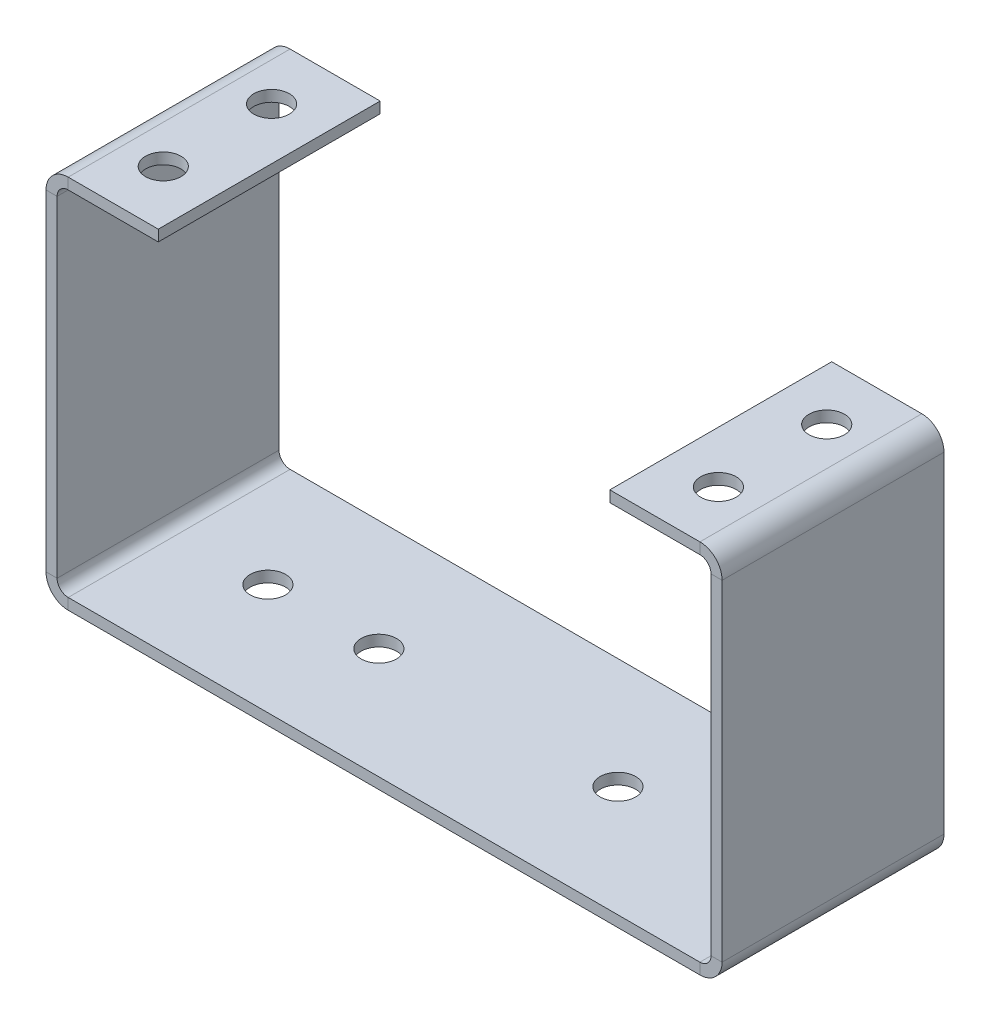
from build123d import *

# Parameters (mm, degrees)
SKETCH_2_W                  = 60.94
SKETCH_2_H                  = 20
EXTRUDE_1_DEPTH             = 1
SKETCH_3_W                  = 1
SKETCH_3_H                  = 20
EXTRUDE_2_DEPTH             = 32.81
SKETCH_4_W                  = 1
SKETCH_4_H                  = 20
EXTRUDE_3_DEPTH             = 32.81
SKETCH_9_W                  = 20
SKETCH_9_H                  = 1
EXTRUDE_8_DEPTH             = 9.12
SKETCH_10_W                 = 20
SKETCH_10_H                 = 1
EXTRUDE_9_DEPTH             = 9.12
SKETCH_13_R                 = 1.6
CUT_EXTRUDE_2_DEPTH         = 1
SKETCH_14_R                 = 1.6
CUT_EXTRUDE_3_DEPTH         = 1
SKETCH_15_R                 = 1.6
CUT_EXTRUDE_4_DEPTH         = 1
SKETCH_16_R                 = 1.6
CUT_EXTRUDE_5_DEPTH         = 1
SKETCH_17_R                 = 1.6
CUT_EXTRUDE_6_DEPTH         = 1
SKETCH_18_R                 = 1.6
CUT_EXTRUDE_7_DEPTH         = 1
SKETCH_19_R                 = 1.6
CUT_EXTRUDE_8_DEPTH         = 1
SHEET_START                 = 1
SHEET_METAL_1_OUTLINE_W     = 10.12
SHEET_METAL_1_OUTLINE_H     = 20
SHEET_METAL_1_OUTLINE_R     = 1.6
SHEET_METAL_1_DEPTH         = 32.81
SHEET_METAL_1_2_OUTLINE_W   = 40.64238898
SHEET_METAL_1_2_OUTLINE_H   = 20
SHEET_METAL_1_2_OUTLINE_R   = 1.6
SHEET_METAL_1_2_DEPTH       = 1
SHEET_START_2               = -20
SHEET_METAL_1_3_DEPTH       = 20
SHEET_START_3               = -13.2799999
SHEET_METAL_1_3_2_DEPTH     = 6.5599998
SHEET_METAL_1_3_3_DEPTH     = 3.5199999
SHEET_START_4               = -3.5199999
SHEET_METAL_1_3_4_DEPTH     = 3.5199999
SHEET_START_5               = -16.4800001
SHEET_METAL_1_3_5_DEPTH     = 12.9600002
SHEET_START_6               = 32.81
SHEET_METAL_1_3_6_OUTLINE_R = 1.6
SHEET_METAL_1_3_6_DEPTH     = 1


with BuildPart() as part:
    # Sketch 2 → ﾎﾞｽ - 押し出し1 (new body)
    with BuildSketch(Plane(origin=(0, 0, 0), x_dir=(1, 0, 0), z_dir=(0, 1, 0))):
        with Locations((30.47, 10)):
            Rectangle(SKETCH_2_W, SKETCH_2_H)
    extrude(amount=EXTRUDE_1_DEPTH)

    # ｽｹｯﾁ3 → ﾎﾞｽ - 押し出し2 (add)
    with BuildSketch(Plane(origin=(0, 1, 0), x_dir=(1, 0, 0), z_dir=(0, 1, 0))):
        with Locations((60.44, 10)):
            Rectangle(SKETCH_3_W, SKETCH_3_H)
    extrude(amount=EXTRUDE_2_DEPTH)

    # ｽｹｯﾁ4 → ﾎﾞｽ - 押し出し3 (add)
    with BuildSketch(Plane(origin=(0, 1, 0), x_dir=(1, 0, 0), z_dir=(0, 1, 0))):
        with Locations((0.5, 10)):
            Rectangle(SKETCH_4_W, SKETCH_4_H)
    extrude(amount=EXTRUDE_3_DEPTH)

    # ｽｹｯﾁ9 → ﾎﾞｽ - 押し出し8 (add)
    with BuildSketch(Plane.ZY.offset(-59.94)):
        with Locations((-10, 33.31)):
            Rectangle(SKETCH_9_W, SKETCH_9_H)
    extrude(amount=EXTRUDE_8_DEPTH)

    # ｽｹｯﾁ10 → ﾎﾞｽ - 押し出し9 (add)
    with BuildSketch(Plane(origin=(1, 0, 0), x_dir=(0, 0, -1), z_dir=(1, 0, 0))):
        with Locations((10, 33.31)):
            Rectangle(SKETCH_10_W, SKETCH_10_H)
    extrude(amount=EXTRUDE_9_DEPTH)

    # ｽｹｯﾁ13 → ｶｯﾄ - 押し出し2 (cut)
    with BuildSketch(Plane(origin=(0, 33.81, 0), x_dir=(1, 0, 0), z_dir=(0, 1, 0))):
        with Locations(Location((55.49, 5.12, 0), (0, 0, 270))):
            Circle(SKETCH_13_R)
    extrude(amount=-CUT_EXTRUDE_2_DEPTH, mode=Mode.SUBTRACT)

    # ｽｹｯﾁ14 → ｶｯﾄ - 押し出し3 (cut)
    with BuildSketch(Plane(origin=(0, 33.81, 0), x_dir=(1, 0, 0), z_dir=(0, 1, 0))):
        with Locations(Location((55.49, 14.88, 0), (0, 0, 270))):
            Circle(SKETCH_14_R)
    extrude(amount=-CUT_EXTRUDE_3_DEPTH, mode=Mode.SUBTRACT)

    # ｽｹｯﾁ15 → ｶｯﾄ - 押し出し4 (cut)
    with BuildSketch(Plane(origin=(0, 33.81, 0), x_dir=(1, 0, 0), z_dir=(0, 1, 0))):
        with Locations(Location((5.45, 5.12, 0), (0, 0, 270))):
            Circle(SKETCH_15_R)
    extrude(amount=-CUT_EXTRUDE_4_DEPTH, mode=Mode.SUBTRACT)

    # ｽｹｯﾁ16 → ｶｯﾄ - 押し出し5 (cut)
    with BuildSketch(Plane(origin=(0, 33.81, 0), x_dir=(1, 0, 0), z_dir=(0, 1, 0))):
        with Locations(Location((5.45, 14.88, 0), (0, 0, 270))):
            Circle(SKETCH_16_R)
    extrude(amount=-CUT_EXTRUDE_5_DEPTH, mode=Mode.SUBTRACT)

    # ｽｹｯﾁ17 → ｶｯﾄ - 押し出し6 (cut)
    with BuildSketch(Plane(origin=(0, 0, 0), x_dir=(-1, 0, 0), z_dir=(0, -1, 0))):
        with Locations(Location((-41.55, 10, 0), (0, 0, 90))):
            Circle(SKETCH_17_R)
    extrude(amount=-CUT_EXTRUDE_6_DEPTH, mode=Mode.SUBTRACT)

    # ｽｹｯﾁ18 → ｶｯﾄ - 押し出し7 (cut)
    with BuildSketch(Plane(origin=(0, 0, 0), x_dir=(-1, 0, 0), z_dir=(0, -1, 0))):
        with Locations(Location((-10, 10, 0), (0, 0, 90))):
            Circle(SKETCH_18_R)
    extrude(amount=-CUT_EXTRUDE_7_DEPTH, mode=Mode.SUBTRACT)

    # ｽｹｯﾁ19 → ｶｯﾄ - 押し出し8 (cut)
    with BuildSketch(Plane(origin=(0, 0, 0), x_dir=(-1, 0, 0), z_dir=(0, -1, 0))):
        with Locations(Location((-20, 10, 0), (0, 0, 90))):
            Circle(SKETCH_19_R)
    extrude(amount=-CUT_EXTRUDE_8_DEPTH, mode=Mode.SUBTRACT)

    # Sheet Metal 1: read off the stored shape, not the designer's step
    # Sheet Metal 1 outline → Sheet Metal 1 (cut)
    # profile 1 of 2: a face of its own
    with BuildSketch(Plane(origin=(0, 0, 0), x_dir=(1, 0, 0), z_dir=(0, 1, 0)).offset(SHEET_START)):
        with Locations((55.88, 10)):
            Rectangle(SHEET_METAL_1_OUTLINE_W, SHEET_METAL_1_OUTLINE_H)
        with Locations((55.49, 14.88)):
            Circle(SHEET_METAL_1_OUTLINE_R, mode=Mode.SUBTRACT)
        with Locations((55.49, 5.12)):
            Circle(SHEET_METAL_1_OUTLINE_R, mode=Mode.SUBTRACT)
    # profile 2 of 2: a face of its own
    with BuildSketch(Plane(origin=(0, 0, 0), x_dir=(1, 0, 0), z_dir=(0, 1, 0)).offset(SHEET_START)):
        with Locations((5.06, 10)):
            Rectangle(SHEET_METAL_1_OUTLINE_W, SHEET_METAL_1_OUTLINE_H)
        with Locations((5.45, 5.12)):
            Circle(SHEET_METAL_1_OUTLINE_R, mode=Mode.SUBTRACT)
        with Locations((5.45, 14.88)):
            Circle(SHEET_METAL_1_OUTLINE_R, mode=Mode.SUBTRACT)
    extrude(amount=SHEET_METAL_1_DEPTH, mode=Mode.SUBTRACT)

    # Sheet Metal 1 2 outline → Sheet Metal 1 2 (add)
    # profile 1 of 2: a face of its own
    with BuildSketch(Plane(origin=(0, 0, 0), x_dir=(1, 0, 0), z_dir=(0, 1, 0))):
        with Locations((81.26119449, 10)):
            Rectangle(SHEET_METAL_1_2_OUTLINE_W, SHEET_METAL_1_2_OUTLINE_H)
        with Locations((96.91238898, 5.12)):
            Circle(SHEET_METAL_1_2_OUTLINE_R, mode=Mode.SUBTRACT)
        with Locations((96.91238898, 14.88)):
            Circle(SHEET_METAL_1_2_OUTLINE_R, mode=Mode.SUBTRACT)
    # profile 2 of 2: a face of its own
    with BuildSketch(Plane(origin=(0, 0, 0), x_dir=(1, 0, 0), z_dir=(0, 1, 0))):
        with Locations((-20.32119449, 10)):
            Rectangle(SHEET_METAL_1_2_OUTLINE_W, SHEET_METAL_1_2_OUTLINE_H)
        with Locations((-35.97238898, 5.12)):
            Circle(SHEET_METAL_1_2_OUTLINE_R, mode=Mode.SUBTRACT)
        with Locations((-35.97238898, 14.88)):
            Circle(SHEET_METAL_1_2_OUTLINE_R, mode=Mode.SUBTRACT)
    extrude(amount=SHEET_METAL_1_2_DEPTH)

    # Sheet Metal 1 3: read off the stored shape, not the designer's step
    # Sheet Metal 1 3 outline → Sheet Metal 1 3 (cut)
    with BuildSketch(Plane.XY.offset(SHEET_START_2)):
        with BuildLine():
            ThreePointArc((2, 0), (1, 0.267949193), (0.267949193, 1))
            Line((0.267949193, 1), (-40.64238898, 1))
            Line((-40.64238898, 1), (-40.64238898, 0))
            Line((-40.64238898, 0), (2, 0))
        make_face()
        with BuildLine():
            Line((101.58238898, 1), (60.672050807, 1))
            ThreePointArc((60.672050807, 1), (59.94, 0.267949193), (58.94, 0))
            Line((58.94, 0), (101.58238898, 0))
            Line((101.58238898, 0), (101.58238898, 1))
        make_face()
    extrude(amount=SHEET_METAL_1_3_DEPTH, mode=Mode.SUBTRACT)

    # Sheet Metal 1 3 2 outline → Sheet Metal 1 3 2 (add)
    with BuildSketch(Plane.XY.offset(SHEET_START_3)):
        with BuildLine():
            Line((2, 32.81), (10.12, 32.81))
            Line((10.12, 32.81), (10.12, 33.81))
            Line((10.12, 33.81), (2, 33.81))
            ThreePointArc((2, 33.81), (0.585786438, 33.224213562), (0, 31.81))
            Line((0, 31.81), (0, 2))
            ThreePointArc((0, 2), (0.068148348, 1.48236191), (0.267949193, 1))
            Line((0.267949193, 1), (2, 1))
            ThreePointArc((2, 1), (1.292893219, 1.292893219), (1, 2))
            Line((1, 2), (1, 31.81))
            ThreePointArc((1, 31.81), (1.292893219, 32.517106781), (2, 32.81))
        make_face()
        with BuildLine():
            Line((58.94, 33.81), (50.82, 33.81))
            Line((50.82, 33.81), (50.82, 32.81))
            Line((50.82, 32.81), (58.94, 32.81))
            ThreePointArc((58.94, 32.81), (59.647106781, 32.517106781), (59.94, 31.81))
            Line((59.94, 31.81), (59.94, 2))
            ThreePointArc((59.94, 2), (59.647106781, 1.292893219), (58.94, 1))
            Line((58.94, 1), (60.672050807, 1))
            ThreePointArc((60.672050807, 1), (60.871851652, 1.48236191), (60.94, 2))
            Line((60.94, 2), (60.94, 31.81))
            ThreePointArc((60.94, 31.81), (60.354213562, 33.224213562), (58.94, 33.81))
        make_face()
    extrude(amount=SHEET_METAL_1_3_2_DEPTH)

    # Sheet Metal 1 3 3 outline → Sheet Metal 1 3 3 (add)
    with BuildSketch(Plane.XY.offset(SHEET_START_2)):
        with BuildLine():
            Line((2, 32.81), (10.12, 32.81))
            Line((10.12, 32.81), (10.12, 33.81))
            Line((10.12, 33.81), (2, 33.81))
            ThreePointArc((2, 33.81), (0.585786438, 33.224213562), (0, 31.81))
            Line((0, 31.81), (0, 2))
            ThreePointArc((0, 2), (0.068148348, 1.48236191), (0.267949193, 1))
            Line((0.267949193, 1), (2, 1))
            ThreePointArc((2, 1), (1.292893219, 1.292893219), (1, 2))
            Line((1, 2), (1, 31.81))
            ThreePointArc((1, 31.81), (1.292893219, 32.517106781), (2, 32.81))
        make_face()
        with BuildLine():
            Line((58.94, 33.81), (50.82, 33.81))
            Line((50.82, 33.81), (50.82, 32.81))
            Line((50.82, 32.81), (58.94, 32.81))
            ThreePointArc((58.94, 32.81), (59.647106781, 32.517106781), (59.94, 31.81))
            Line((59.94, 31.81), (59.94, 2))
            ThreePointArc((59.94, 2), (59.647106781, 1.292893219), (58.94, 1))
            Line((58.94, 1), (60.672050807, 1))
            ThreePointArc((60.672050807, 1), (60.871851652, 1.48236191), (60.94, 2))
            Line((60.94, 2), (60.94, 31.81))
            ThreePointArc((60.94, 31.81), (60.354213562, 33.224213562), (58.94, 33.81))
        make_face()
    extrude(amount=SHEET_METAL_1_3_3_DEPTH)

    # Sheet Metal 1 3 4 outline → Sheet Metal 1 3 4 (add)
    with BuildSketch(Plane.XY.offset(SHEET_START_4)):
        with BuildLine():
            Line((2, 32.81), (10.12, 32.81))
            Line((10.12, 32.81), (10.12, 33.81))
            Line((10.12, 33.81), (2, 33.81))
            ThreePointArc((2, 33.81), (0.585786438, 33.224213562), (0, 31.81))
            Line((0, 31.81), (0, 2))
            ThreePointArc((0, 2), (0.068148348, 1.48236191), (0.267949193, 1))
            Line((0.267949193, 1), (2, 1))
            ThreePointArc((2, 1), (1.292893219, 1.292893219), (1, 2))
            Line((1, 2), (1, 31.81))
            ThreePointArc((1, 31.81), (1.292893219, 32.517106781), (2, 32.81))
        make_face()
        with BuildLine():
            Line((58.94, 33.81), (50.82, 33.81))
            Line((50.82, 33.81), (50.82, 32.81))
            Line((50.82, 32.81), (58.94, 32.81))
            ThreePointArc((58.94, 32.81), (59.647106781, 32.517106781), (59.94, 31.81))
            Line((59.94, 31.81), (59.94, 2))
            ThreePointArc((59.94, 2), (59.647106781, 1.292893219), (58.94, 1))
            Line((58.94, 1), (60.672050807, 1))
            ThreePointArc((60.672050807, 1), (60.871851652, 1.48236191), (60.94, 2))
            Line((60.94, 2), (60.94, 31.81))
            ThreePointArc((60.94, 31.81), (60.354213562, 33.224213562), (58.94, 33.81))
        make_face()
    extrude(amount=SHEET_METAL_1_3_4_DEPTH)

    # Sheet Metal 1 3 5 outline → Sheet Metal 1 3 5 (add)
    with BuildSketch(Plane.XY.offset(SHEET_START_5)):
        with BuildLine():
            Line((2, 32.81), (10.12, 32.81))
            Line((10.12, 32.81), (10.12, 33.81))
            Line((10.12, 33.81), (2, 33.81))
            ThreePointArc((2, 33.81), (0.585786438, 33.224213562), (0, 31.81))
            Line((0, 31.81), (0, 2))
            ThreePointArc((0, 2), (0.068148348, 1.48236191), (0.267949193, 1))
            Line((0.267949193, 1), (2, 1))
            ThreePointArc((2, 1), (1.292893219, 1.292893219), (1, 2))
            Line((1, 2), (1, 31.81))
            ThreePointArc((1, 31.81), (1.292893219, 32.517106781), (2, 32.81))
        make_face()
        with BuildLine():
            ThreePointArc((59.94, 2), (59.647106781, 1.292893219), (58.94, 1))
            Line((58.94, 1), (60.672050807, 1))
            ThreePointArc((60.672050807, 1), (60.871851652, 1.48236191), (60.94, 2))
            Line((60.94, 2), (60.94, 31.81))
            ThreePointArc((60.94, 31.81), (60.354213562, 33.224213562), (58.94, 33.81))
            Line((58.94, 33.81), (50.82, 33.81))
            Line((50.82, 33.81), (50.82, 32.81))
            Line((50.82, 32.81), (58.94, 32.81))
            ThreePointArc((58.94, 32.81), (59.647106781, 32.517106781), (59.94, 31.81))
            Line((59.94, 31.81), (59.94, 2))
        make_face()
    extrude(amount=SHEET_METAL_1_3_5_DEPTH)

    # Sheet Metal 1 3 6 outline → Sheet Metal 1 3 6 (cut)
    with BuildSketch(Plane(origin=(0, 0, 0), x_dir=(1, 0, 0), z_dir=(0, 1, 0)).offset(SHEET_START_6)):
        with Locations((5.45, 5.12)):
            Circle(SHEET_METAL_1_3_6_OUTLINE_R)
        with Locations((5.45, 14.88)):
            Circle(SHEET_METAL_1_3_6_OUTLINE_R)
        with Locations((55.49, 5.12)):
            Circle(SHEET_METAL_1_3_6_OUTLINE_R)
        with Locations((55.49, 14.88)):
            Circle(SHEET_METAL_1_3_6_OUTLINE_R)
    extrude(amount=SHEET_METAL_1_3_6_DEPTH, mode=Mode.SUBTRACT)


solid = part.part
